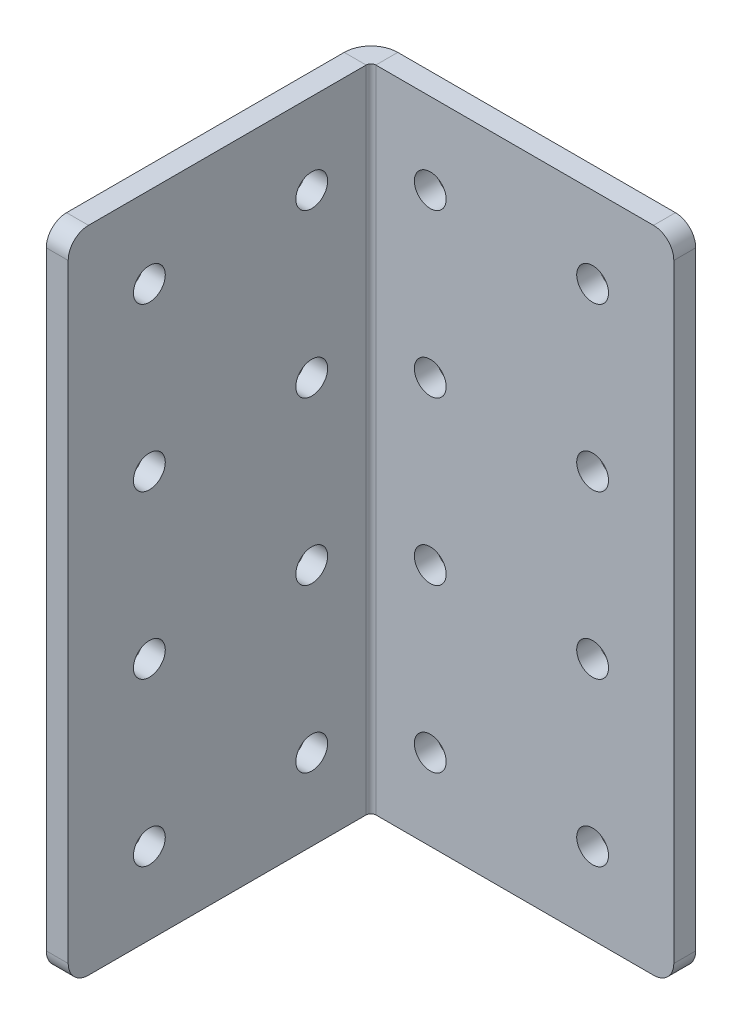
from build123d import *

# Parameters (mm, degrees)
BASE_FLANGE1_DEPTH = 50.8
SKETCH6_R          = 2.4892
CUT_EXTRUDE1_DEPTH = 87.054004212
SKETCH7_R          = 2.4892
CUT_EXTRUDE2_DEPTH = 87.054004212
FILLET1_R          = 3.175


# Sheet-metal steps are written as plain solids
with BuildPart() as part:
    # Sketch1 → Base-Flange1 (new, symmetric)
    with BuildSketch(Plane(origin=(0, 0, 0), x_dir=(1, 0, 0), z_dir=(0, 1, 0))):
        with BuildLine():
            Line((50.8, 0), (4.191, 0))
            ThreePointArc((4.191, 0), (1.22751548, -1.22751548), (0, -4.191))
            Line((0, -4.191), (0, -50.8))
            Line((0, -50.8), (3.429, -50.8))
            Line((3.429, -50.8), (3.429, -4.191))
            ThreePointArc((3.429, -4.191), (3.652184633, -3.652184633), (4.191, -3.429))
            Line((4.191, -3.429), (50.8, -3.429))
            Line((50.8, -3.429), (50.8, 0))
        make_face()
    extrude(amount=BASE_FLANGE1_DEPTH, both=True)

    # Sketch6 → Cut-Extrude1 (cut, through all)
    with BuildSketch(Plane(origin=(3.429, 0, 0), x_dir=(0, 0, -1), z_dir=(1, 0, 0))):
        with Locations((-38.1, 38.1)):
            Circle(SKETCH6_R)
        with Locations((-12.7, 38.1)):
            Circle(SKETCH6_R)
        with Locations((-38.1, 12.7)):
            Circle(SKETCH6_R)
        with Locations((-12.7, 12.7)):
            Circle(SKETCH6_R)
        with Locations((-38.1, -12.7)):
            Circle(SKETCH6_R)
        with Locations((-12.7, -12.7)):
            Circle(SKETCH6_R)
        with Locations((-38.1, -38.1)):
            Circle(SKETCH6_R)
        with Locations((-12.7, -38.1)):
            Circle(SKETCH6_R)
    extrude(amount=-CUT_EXTRUDE1_DEPTH, mode=Mode.SUBTRACT)

    # Sketch7 → Cut-Extrude2 (cut, through all)
    with BuildSketch(Plane.XY.offset(3.429)):
        with Locations((12.7, 38.1)):
            Circle(SKETCH7_R)
        with Locations((38.1, 38.1)):
            Circle(SKETCH7_R)
        with Locations((12.7, 12.7)):
            Circle(SKETCH7_R)
        with Locations((38.1, 12.7)):
            Circle(SKETCH7_R)
        with Locations((12.7, -12.7)):
            Circle(SKETCH7_R)
        with Locations((38.1, -12.7)):
            Circle(SKETCH7_R)
        with Locations((12.7, -38.1)):
            Circle(SKETCH7_R)
        with Locations((38.1, -38.1)):
            Circle(SKETCH7_R)
    extrude(amount=-CUT_EXTRUDE2_DEPTH, mode=Mode.SUBTRACT)

    # Fillet1
    fillet1_edges = [part.edges().sort_by_distance(p)[0] for p in [
        (1.7145, 50.8, 50.8),
        (1.7145, -50.8, 50.8),
        (50.8, 50.8, 1.7145),
        (50.8, -50.8, 1.7145),
    ]]
    fillet(fillet1_edges, radius=FILLET1_R)


solid = part.part
